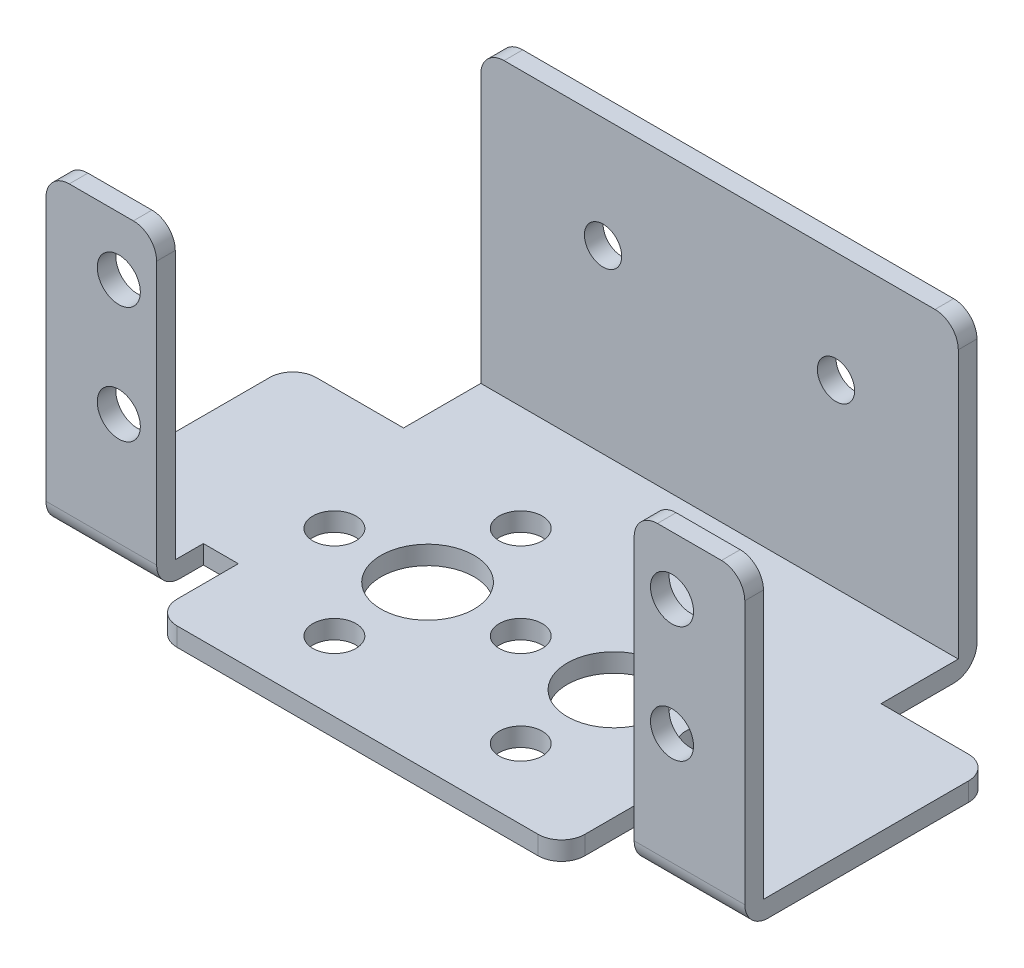
from build123d import *

# Parameters (mm, degrees)
EXTRUDE1_DEPTH           = 1.6
SKETCH2_W                = 9.5
SKETCH2_H                = 1.6
SKETCH2_W_2              = 41
EXTRUDE2_DEPTH           = 25
SKETCH3_R                = 1.85
CUT_EXTRUDE1_DEPTH       = 72.928615584
SKETCH4_R                = 1.6
CUT_EXTRUDE2_DEPTH       = 25
CUT_EXTRUDE3_START       = -1.6
CUT_EXTRUDE3_OUTLINE_R   = 1.85
CUT_EXTRUDE3_OUTLINE_R_2 = 4
CUT_EXTRUDE3_DEPTH       = 1.6
FILLET1_R                = 2
FILLET2_R                = 2
FILLET3_R                = 2
FILLET4_R                = 2
FILLET5_R                = 2
FILLET6_R                = 2
FILLET7_R                = 2
FILLET8_R                = 2
FILLET9_R                = 2
FILLET10_R               = 2
FILLET11_R               = 2
FILLET12_R               = 2
FILLET13_R               = 2


# Read off the part's stored shape, not the designer's step: Cut-Extrude3
with BuildPart() as part:
    # Sketch1 → Extrude1 (new body)
    with BuildSketch(Plane(origin=(0, 0, 0), x_dir=(1, 0, 0), z_dir=(0, 1, 0))):
        Polygon((0, 0), (0, 21.2), (9.5, 21.2), (9.5, 29.43069384), (50.5, 29.43069384), (50.5, 21.2), (60, 21.2), (60, 0), (50.5, 0), (50.5, 4.011974119), (47.5, 4.011974119), (47.5, -3.238875216), (12.5, -3.238875216), (12.5, 4.011974119), (9.5, 4.011974119), (9.5, 0), align=None)
    extrude(amount=EXTRUDE1_DEPTH)

    # Sketch2 → Extrude2 (add)
    with BuildSketch(Plane(origin=(0, 1.6, 0), x_dir=(1, 0, 0), z_dir=(0, 1, 0))):
        with Locations((4.75, 0.8)):
            Rectangle(SKETCH2_W, SKETCH2_H)
        with Locations((55.25, 0.8)):
            Rectangle(SKETCH2_W, SKETCH2_H)
        with Locations((30, 28.63069384)):
            Rectangle(SKETCH2_W_2, SKETCH2_H)
    extrude(amount=EXTRUDE2_DEPTH)

    # Sketch3 → Cut-Extrude1 (cut, through all)
    with BuildSketch(Plane.XY):
        with Locations((6.25, 21.6)):
            Circle(SKETCH3_R)
        with Locations((6.25, 11.6)):
            Circle(SKETCH3_R)
        with Locations((53.75, 21.6)):
            Circle(SKETCH3_R)
        with Locations((53.75, 11.6)):
            Circle(SKETCH3_R)
    extrude(amount=-CUT_EXTRUDE1_DEPTH, mode=Mode.SUBTRACT)

    # Sketch4 → Cut-Extrude2 (cut)
    with BuildSketch(Plane.XY.offset(-27.83069384)):
        with Locations((20, 17.094459231)):
            Circle(SKETCH4_R)
        with Locations((40, 17.094459231)):
            Circle(SKETCH4_R)
    extrude(amount=-CUT_EXTRUDE2_DEPTH, mode=Mode.SUBTRACT)

    # Cut-Extrude3 outline → Cut-Extrude3 (cut)
    with BuildSketch(Plane.XZ.offset(CUT_EXTRUDE3_START)):
        with Locations((14, -10.761124784)):
            Circle(CUT_EXTRUDE3_OUTLINE_R)
        with Locations((22, -10.761124784)):
            Circle(CUT_EXTRUDE3_OUTLINE_R_2)
        with Locations((30, -10.761124784)):
            Circle(CUT_EXTRUDE3_OUTLINE_R)
        with Locations((22, -18.761124784)):
            Circle(CUT_EXTRUDE3_OUTLINE_R)
        with Locations((22, -2.761124784)):
            Circle(CUT_EXTRUDE3_OUTLINE_R)
        with Locations((38, -10.761124784)):
            Circle(CUT_EXTRUDE3_OUTLINE_R_2)
        with Locations((46, -10.761124784)):
            Circle(CUT_EXTRUDE3_OUTLINE_R)
        with Locations((38, -18.761124784)):
            Circle(CUT_EXTRUDE3_OUTLINE_R)
        with Locations((38, -2.761124784)):
            Circle(CUT_EXTRUDE3_OUTLINE_R)
    extrude(amount=CUT_EXTRUDE3_DEPTH, mode=Mode.SUBTRACT)

    # Fillet1
    fillet1_edges = [part.edges().sort_by_distance(p)[0] for p in [
        (47.5, 0.8, 3.238875216),
    ]]
    fillet(fillet1_edges, radius=FILLET1_R)

    # Fillet2
    fillet2_edges = [part.edges().sort_by_distance(p)[0] for p in [
        (12.5, 0.8, 3.238875216),
    ]]
    fillet(fillet2_edges, radius=FILLET2_R)

    # Fillet3
    fillet3_edges = [part.edges().sort_by_distance(p)[0] for p in [
        (60, 26.6, -0.8),
    ]]
    fillet(fillet3_edges, radius=FILLET3_R)

    # Fillet4
    fillet4_edges = [part.edges().sort_by_distance(p)[0] for p in [
        (9.5, 26.6, -0.8),
    ]]
    fillet(fillet4_edges, radius=FILLET4_R)

    # Fillet5
    fillet5_edges = [part.edges().sort_by_distance(p)[0] for p in [
        (50.5, 26.6, -28.63069384),
    ]]
    fillet(fillet5_edges, radius=FILLET5_R)

    # Fillet6
    fillet6_edges = [part.edges().sort_by_distance(p)[0] for p in [
        (50.5, 26.6, -0.8),
    ]]
    fillet(fillet6_edges, radius=FILLET6_R)

    # Fillet7
    fillet7_edges = [part.edges().sort_by_distance(p)[0] for p in [
        (0, 26.6, -0.8),
    ]]
    fillet(fillet7_edges, radius=FILLET7_R)

    # Fillet8
    fillet8_edges = [part.edges().sort_by_distance(p)[0] for p in [
        (9.5, 26.6, -28.63069384),
    ]]
    fillet(fillet8_edges, radius=FILLET8_R)

    # Fillet9
    fillet9_edges = [part.edges().sort_by_distance(p)[0] for p in [
        (0, 0.8, -21.2),
    ]]
    fillet(fillet9_edges, radius=FILLET9_R)

    # Fillet10
    fillet10_edges = [part.edges().sort_by_distance(p)[0] for p in [
        (60, 0.8, -21.2),
    ]]
    fillet(fillet10_edges, radius=FILLET10_R)

    # Fillet11
    fillet11_edges = [part.edges().sort_by_distance(p)[0] for p in [
        (30, 0, -29.43069384),
    ]]
    fillet(fillet11_edges, radius=FILLET11_R)

    # Fillet12
    fillet12_edges = [part.edges().sort_by_distance(p)[0] for p in [
        (55.25, 0, 0),
    ]]
    fillet(fillet12_edges, radius=FILLET12_R)

    # Fillet13
    fillet13_edges = [part.edges().sort_by_distance(p)[0] for p in [
        (4.75, 0, 0),
    ]]
    fillet(fillet13_edges, radius=FILLET13_R)


solid = part.part
